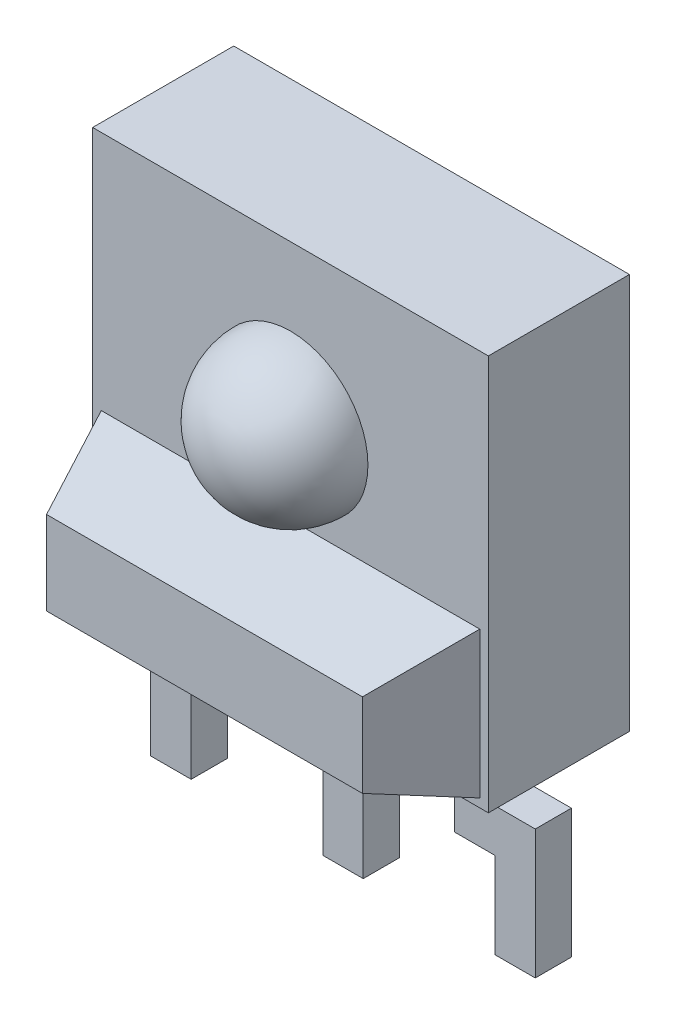
from build123d import *

# Parameters (mm, degrees)
BOSS_EXTRUDE1_DEPTH   = 0.21
SKETCH1_W             = 0.47
SKETCH1_H             = 2
BOSS_EXTRUDE1_2_DEPTH = 0.21
BOSS_EXTRUDE1_3_DEPTH = 0.21
SKETCH2_W             = 4.6
SKETCH2_H             = 1.64
BOSS_EXTRUDE2_DEPTH   = 4.6
REVOLVE1_ANGLE        = 180
SKETCH4_W             = 4.4
SKETCH4_H             = 1.7
BOSS_EXTRUDE3_DEPTH   = 1
CHAMFER1_SIZE         = 1
CHAMFER1_SIZE_2       = 0.363970234


with BuildPart() as part:
    # Sketch1 → Boss-Extrude1 (new, symmetric)
    with BuildSketch(Plane.XY):
        Polygon((-1.295, 1), (-1.295, 0), (-1.765, 0), (-1.765, -1), (-2.235, -1), (-2.235, 0.5), (-1.765, 0.5), (-1.765, 1), align=None)
    extrude(amount=BOSS_EXTRUDE1_DEPTH, both=True)



with BuildPart() as body_2:
    # Sketch1 → Boss-Extrude1 2 (new, symmetric)
    with BuildSketch(Plane.XY):
        Rectangle(SKETCH1_W, SKETCH1_H)
    extrude(amount=BOSS_EXTRUDE1_2_DEPTH, both=True)


with BuildPart() as body_3:
    # Sketch1 → Boss-Extrude1 3 (new, symmetric)
    with BuildSketch(Plane.XY):
        Polygon((1.765, 1), (1.295, 1), (1.295, 0), (1.765, 0), (1.765, -1), (2.235, -1), (2.235, 0.5), (1.765, 0.5), align=None)
    extrude(amount=BOSS_EXTRUDE1_3_DEPTH, both=True)


with BuildPart() as part_1:
    add(part.part)

    add(body_2.part)  # Boss-Extrude2 merges body 2

    add(body_3.part)  # Boss-Extrude2 merges body 3
    # Sketch2 → Boss-Extrude2 (add)
    with BuildSketch(Plane(origin=(0, 1, 0), x_dir=(1, 0, 0), z_dir=(0, 1, 0))):
        Rectangle(SKETCH2_W, SKETCH2_H)
    extrude(amount=BOSS_EXTRUDE2_DEPTH)

    # Sketch3 → Revolve1 (revolve)
    with BuildSketch(Plane.XY.offset(0.82)):
        with BuildLine():
            Line((0, 4.7), (0, 2.9))
            ThreePointArc((0, 2.9), (0.9, 3.8), (0, 4.7))
        make_face()
    revolve(axis=Axis((0, 4.7, 0.82), (0, -1, 0)), revolution_arc=REVOLVE1_ANGLE)

    # Sketch4 → Boss-Extrude3 (add)
    with BuildSketch(Plane.XY.offset(0.82)):
        with Locations((0, 1.95)):
            Rectangle(SKETCH4_W, SKETCH4_H)
    extrude(amount=BOSS_EXTRUDE3_DEPTH)

    # Chamfer1
    # the kernel refuses this chamfer: 1, 0.363970234 mm, written as the material it takes off along each edge
    with BuildSketch(Plane(origin=(4.794194733, 1.1, 1.82), x_dir=(0, -0.013184058198646006, -0.9999130865277315), z_dir=(-1, 0, 0))) as chamfer1_piece_1_section:
        Polygon((CHAMFER1_SIZE * 0.999913086528, -CHAMFER1_SIZE * 0.0131840581986), (-CHAMFER1_SIZE_2 * 0.0131840582083, -CHAMFER1_SIZE_2 * 0.999913087259), (0, 0), align=None)
    chamfer1_piece_1 = extrude(amount=9.588389465, mode=Mode.PRIVATE)
    chamfer1_piece_1 = split(chamfer1_piece_1, bisect_by=Plane(origin=(0, 1.212526608, 0.82), z_dir=(0, 0, 1)), keep=Keep.TOP, mode=Mode.PRIVATE)
    add(chamfer1_piece_1, mode=Mode.SUBTRACT)
    with BuildSketch(Plane(origin=(-2.2, -1.494194733, 1.82), x_dir=(-0.013184058198646006, 0, -0.9999130865277315), z_dir=(0, 1, 0))) as chamfer1_piece_2_section:
        Polygon((CHAMFER1_SIZE * 0.999913086528, -CHAMFER1_SIZE * 0.0131840581986), (-CHAMFER1_SIZE_2 * 0.0131840582083, -CHAMFER1_SIZE_2 * 0.999913087259), (0, 0), align=None)
    chamfer1_piece_2 = extrude(amount=6.888389465, mode=Mode.PRIVATE)
    chamfer1_piece_2 = split(chamfer1_piece_2, bisect_by=Plane(origin=(-2.087473392, 1.95, 0.82), z_dir=(0, 0, 1)), keep=Keep.TOP, mode=Mode.PRIVATE)
    add(chamfer1_piece_2, mode=Mode.SUBTRACT)
    with BuildSketch(Plane(origin=(2.2, 5.394194733, 1.82), x_dir=(0.013184058198646006, 0, -0.9999130865277315), z_dir=(0, -1, 0))) as chamfer1_piece_3_section:
        Polygon((CHAMFER1_SIZE * 0.999913086528, -CHAMFER1_SIZE * 0.0131840581986), (-CHAMFER1_SIZE_2 * 0.0131840582083, -CHAMFER1_SIZE_2 * 0.999913087259), (0, 0), align=None)
    chamfer1_piece_3 = extrude(amount=6.888389465, mode=Mode.PRIVATE)
    chamfer1_piece_3 = split(chamfer1_piece_3, bisect_by=Plane(origin=(2.087473392, 1.95, 0.82), z_dir=(0, 0, 1)), keep=Keep.TOP, mode=Mode.PRIVATE)
    add(chamfer1_piece_3, mode=Mode.SUBTRACT)
    with BuildSketch(Plane(origin=(-4.794194733, 2.8, 1.82), x_dir=(0, 0.013184058198646006, -0.9999130865277315), z_dir=(1, 0, 0))) as chamfer1_piece_4_section:
        Polygon((CHAMFER1_SIZE * 0.999913086528, -CHAMFER1_SIZE * 0.0131840581986), (-CHAMFER1_SIZE_2 * 0.0131840582083, -CHAMFER1_SIZE_2 * 0.999913087259), (0, 0), align=None)
    chamfer1_piece_4 = extrude(amount=9.588389465, mode=Mode.PRIVATE)
    chamfer1_piece_4 = split(chamfer1_piece_4, bisect_by=Plane(origin=(0, 2.687473392, 0.82), z_dir=(0, 0, 1)), keep=Keep.TOP, mode=Mode.PRIVATE)
    add(chamfer1_piece_4, mode=Mode.SUBTRACT)


solid = part_1.part
